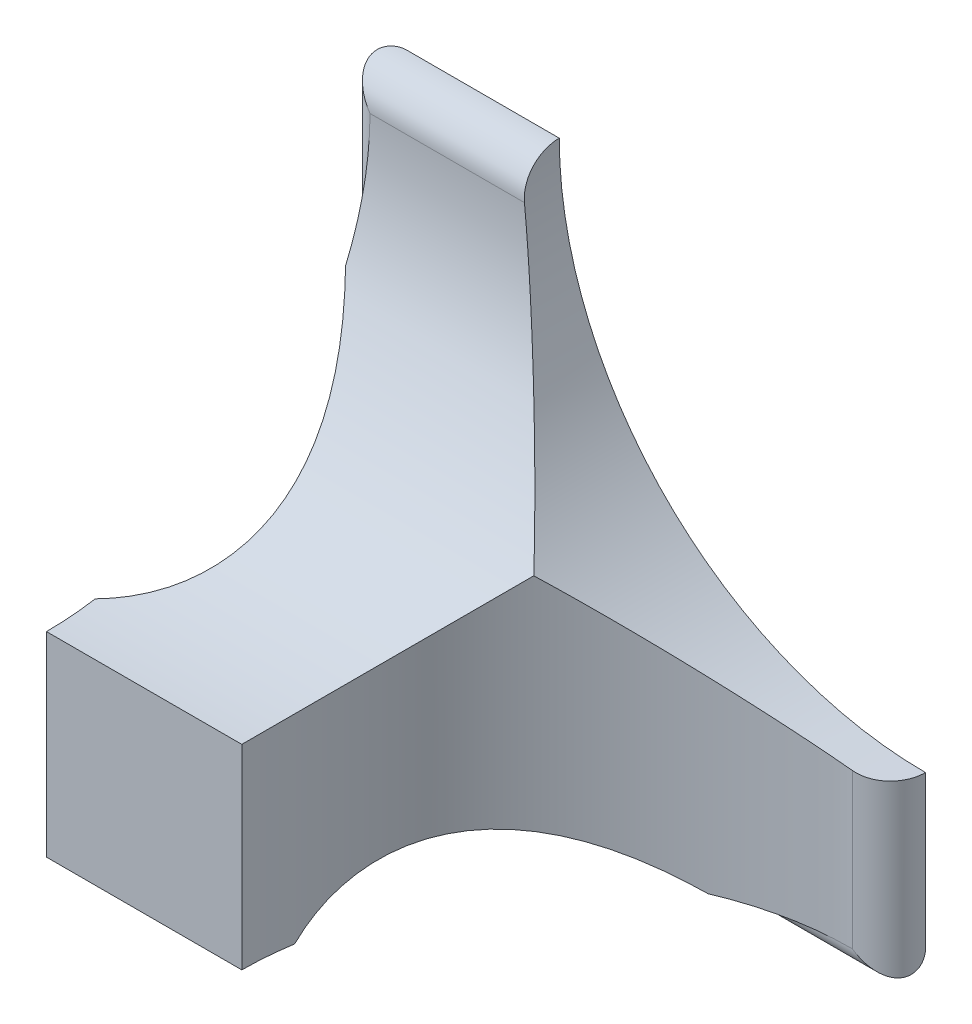
from build123d import *

# Parameters (mm, degrees)
EXTRUDE_494_DEPTH      = 14
CUT_EXTRUDE_1131_DEPTH = 29.45715243
CUT_EXTRUDE_1421_DEPTH = 29.45715243
CUT_EXTRUDE_START      = -3
CUT_EXTRUDE_1834_DEPTH = 32.457152596
CHAMFER_1_SIZE         = 0.5


with BuildPart() as part:
    # Эскиз1 → Extrude 494 (new body)
    with BuildSketch(Plane.XY):
        with BuildLine():
            Line((0, 0), (22, 0))
            Line((22, 0), (22, 7))
            ThreePointArc((22, 7), (16.259748515, 8.141807012), (11.393398282, 11.393398282))
            Line((11.393398282, 11.393398282), (0, 0))
        make_face()
    extrude_494 = extrude(amount=EXTRUDE_494_DEPTH)

    # Эскиз2 → Cut-Extrude 1131 (cut, through all)
    with BuildSketch(Plane(origin=(22, 0, 0), x_dir=(0, 0, -1), z_dir=(1, 0, 0))):
        with BuildLine():
            Line((-14, -1), (0, -1))
            Line((0, -1), (0, 0.75))
            ThreePointArc((0, 0.75), (-0.75, 0), (-1.5, 0.75))
            Line((-1.5, 0.75), (-2.5, 0.75))
            ThreePointArc((-2.5, 0.75), (-7.416188166, 2.480050099), (-12, 0))
            Line((-12, 0), (-14, 0))
            Line((-14, 0), (-14, -1))
        make_face()
    cut_extrude_1131 = extrude(amount=-CUT_EXTRUDE_1131_DEPTH, mode=Mode.SUBTRACT)

    # Эскиз3 → Cut-Extrude 1421 (cut, through all)
    with BuildSketch(Plane(origin=(0, 0, 0), x_dir=(1, 0, 0), z_dir=(0, 1, 0))):
        with BuildLine():
            Line((22, 0), (22, -14))
            Line((22, -14), (8, -14))
            ThreePointArc((8, -14), (11.661165235, -5.161165235), (20.5, -1.5))
            ThreePointArc((20.5, -1.5), (21.560660172, -1.060660172), (22, 0))
        make_face()
    cut_extrude_1421 = extrude(amount=CUT_EXTRUDE_1421_DEPTH, mode=Mode.SUBTRACT)

    # Эскиз5 → Cut-Extrude 1834 (cut)
    with BuildSketch(Plane(origin=(0, 0, 0), x_dir=(-1, 0, 0), z_dir=(0, 0, -1)).offset(CUT_EXTRUDE_START)):
        with BuildLine():
            ThreePointArc((-6.416547622, 6.416547622), (-7.487144673, 5.701197543), (-8.75, 5.45))
            Line((-8.75, 5.45), (-12.75, 5.45))
            Line((-12.75, 5.45), (-12.75, 4.05))
            Line((-12.75, 4.05), (-8.75, 4.05))
            ThreePointArc((-8.75, 4.05), (-6.951387868, 4.407766197), (-5.426598128, 5.426598128))
            Line((-5.426598128, 5.426598128), (-6.416547622, 6.416547622))
        make_face()
    cut_extrude_1834 = extrude(amount=CUT_EXTRUDE_1834_DEPTH, mode=Mode.SUBTRACT)

    # Зеркальное отражение1: Extrude 494, Cut-Extrude 1131, Cut-Extrude 1421, Cut-Extrude 1834 across plane
    add(extrude_494.mirror(Plane(origin=(11.393398282, 11.393398282, 14), x_dir=(0, 0, 1), z_dir=(0.7071067811865488, -0.7071067811865464, 0))))
    add(cut_extrude_1131.mirror(Plane(origin=(11.393398282, 11.393398282, 14), x_dir=(0, 0, 1), z_dir=(0.7071067811865488, -0.7071067811865464, 0))), mode=Mode.SUBTRACT)
    add(cut_extrude_1421.mirror(Plane(origin=(11.393398282, 11.393398282, 14), x_dir=(0, 0, 1), z_dir=(0.7071067811865488, -0.7071067811865464, 0))), mode=Mode.SUBTRACT)
    add(cut_extrude_1834.mirror(Plane(origin=(11.393398282, 11.393398282, 14), x_dir=(0, 0, 1), z_dir=(0.7071067811865488, -0.7071067811865464, 0))), mode=Mode.SUBTRACT)

    # Фаска1
    chamfer_1_edges = [part.edges().sort_by_distance(p)[0] for p in [
        (12.75, 4.75, 0),
        (10.75, 5.45, 0),
        (6.416547622, 6.416547622, 0),
        (10.75, 4.05, 0),
        (5.426598128, 5.426598128, 0),
        (5.45, 10.75, 0),
        (4.05, 10.75, 0),
        (4.75, 12.75, 0),
    ]]
    chamfer(chamfer_1_edges, length=CHAMFER_1_SIZE)


solid = part.part
